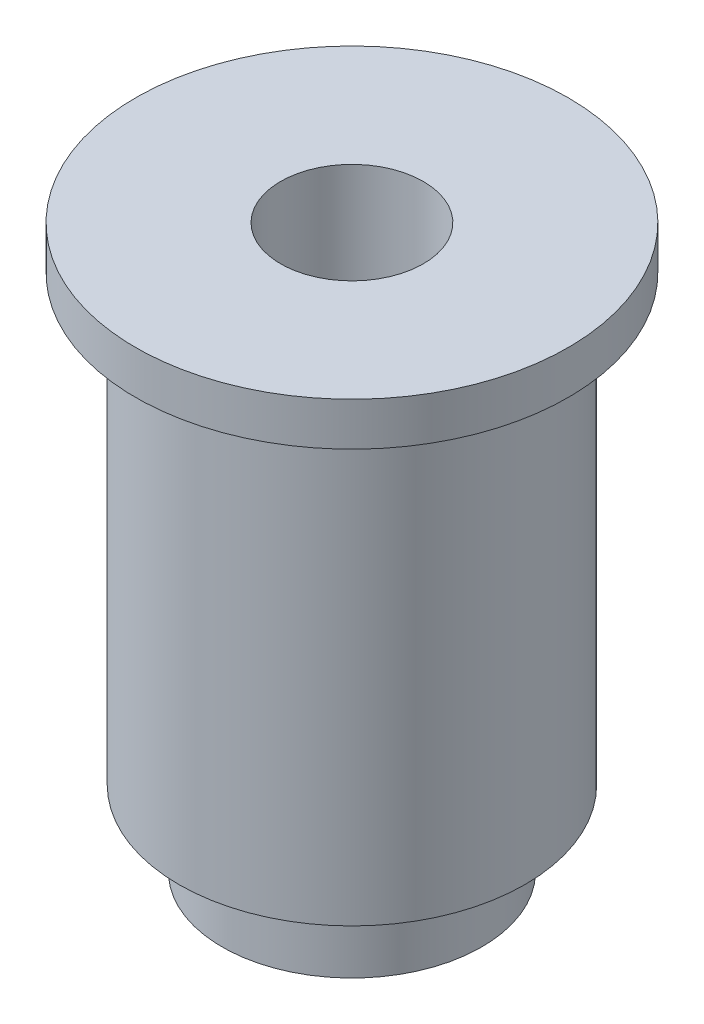
from build123d import *


with BuildPart() as part:
    # Esquisse1 → Révolution1 (revolve)
    with BuildSketch(Plane.XY):
        Polygon((1.65, 13), (5, 13), (5, 12), (4, 12), (4, 1.75), (3, 1.75), (3, 0), (1.65, 0), align=None)
    revolve(axis=Axis((0, 0, 0), (0, 1, 0)))


solid = part.part
